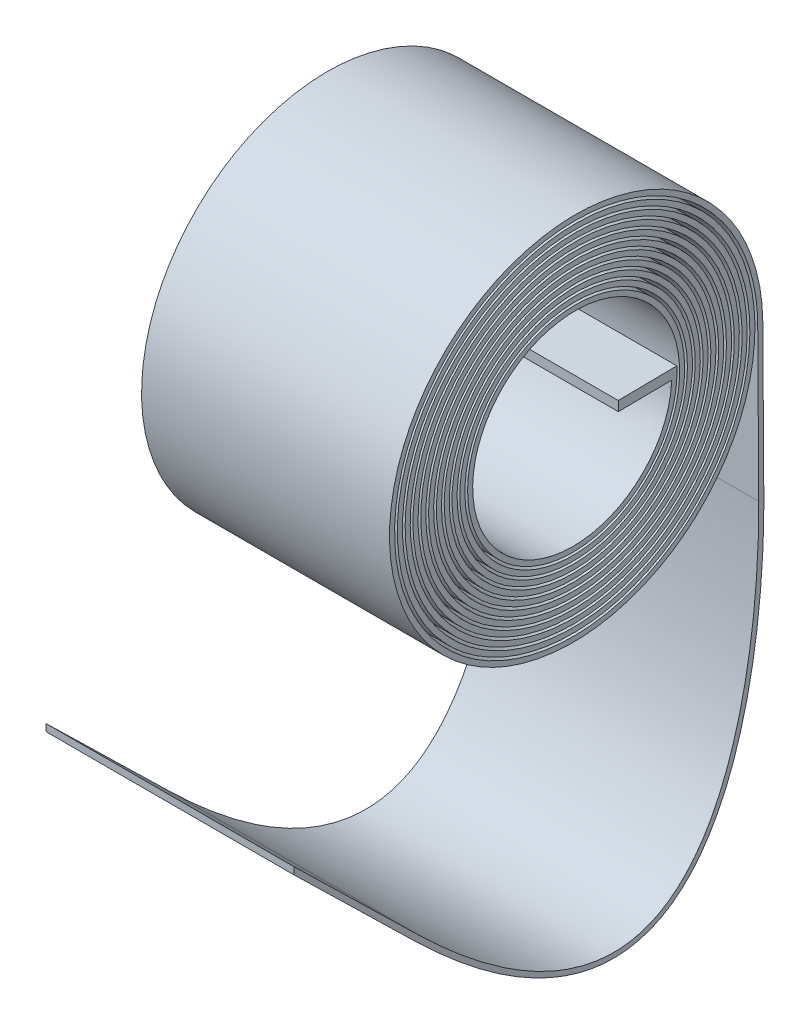
from build123d import *

# Parameters (mm, degrees)
BOSS_EXTRUDE1_DEPTH             = 3.175
BOSS_EXTRUDE2_START             = -3.175
BOSS_EXTRUDE2_DEPTH             = 6.35
BOSS_EXTRUDE3_REACH             = 9.5
BOSS_EXTRUDE3_DIRECTION_2_REACH = 9.5
BOSS_EXTRUDE4_REACH             = 15.516
BOSS_EXTRUDE4_DIRECTION_2_REACH = 15.516


with BuildPart() as part:
    # Sketch2 → Boss-Extrude1 (new, symmetric)
    with BuildSketch(Plane(origin=(0, 0, 0), x_dir=(0, 0, -1), z_dir=(1, 0, 0))):
        with BuildLine():
            Line((2.5, 0), (2.629989464, 0.001655077))
            add(Edge.make_bspline(
                [(2.629989464, 0.001655077), (2.635963048, -0.467509109), (2.386174742, -1.426254548), (1.3228715, -2.463912015), (-0.133184537, -2.81203925), (-1.56988049, -2.358342435), (-2.575295311, -1.223482355), (-2.855850638, 0.276340899), (-2.321964447, 1.715980427), (-1.116319633, 2.682248524), (0.424109992, 2.892390502), (1.862211862, 2.276790995), (2.784768923, 1.001569346), (2.921180104, -0.576112787), (2.222760966, -2.008059754), (0.879404758, -2.882367049), (-0.731935926, -2.941893216), (-2.153003173, -2.15980733), (-2.974560166, -0.75003851), (-2.954225776, 0.891146845), (-2.087893079, 2.296513211), (-0.613712841, 3.060875021), (1.053292415, 2.957896965), (2.438055364, 2.007011844), (3.140849414, 0.470699161), (2.952650537, -1.217900199), (1.917188333, -2.577091277), (0.321297529, -3.214033918), (-1.384479783, -2.938256037), (-2.713080518, -1.818478679), (-3.279993584, -0.165836049), (-2.914509936, 1.552524187), (-1.710970692, 2.845482373), (-0.004670147, 3.338309613), (1.721511339, 2.881236702), (2.973757662, 1.594784014), (3.388580988, -0.161818233), (2.838289781, -1.890905616), (1.47007016, -3.097370569), (-0.333221534, -3.430426071), (-2.060159441, -2.785552495), (-3.215790479, -1.33701247), (-3.463484149, 0.509107584), (-2.72293886, 2.228714941), (-1.195825943, 3.328493817), (0.689020683, 3.487416929), (2.396005649, 2.6503943), (3.434965884, 1.046756981), (3.501909979, -0.872482777), (2.567896279, -2.561458259), (0.890083016, -3.534702682), (-1.058994716, -3.506674101), (-2.724494412, -2.475454827), (-3.627212725, -0.726112043), (-3.501446641, 1.248037594), (-2.373112973, 2.884532528), (-0.555182042, 3.712018828), (1.439074169, 3.48599273), (3.040989658, 2.260947077), (3.788659868, 0.377660305), (3.460106442, -1.631550349), (2.139067051, -3.193283362), (0.193942657, -3.856692518), (-1.824896759, -3.423611881), (-3.340833612, -2.007616484), (-3.915692931, -0.00445258), (-3.376364175, 2.01853036), (-1.866772658, 3.483064701), (0.190359761, 3.965258396), (2.211856143, 3.318250386), (3.619407157, 1.716746456), (4.005008929, -0.390018588), (3.249190332, -2.404268864), (1.557782165, -3.749299667), (-0.594023668, -4.034588818), (-2.595154846, -3.169137308), (-3.872190984, -1.390157167), (-4.053668111, 0.801851569), (-3.078078714, 2.783893812), (-1.214181531, 3.987541834), (1.012956993, 4.061944025), (2.96986077, 2.976036577), (4.0948268, 1.030197485), (4.059142303, -1.2267742), (2.863067977, -3.152427928), (0.838578794, -4.193536181), (-1.442718508, -4.045018483), (-3.330966636, -2.739265363), (-4.283177828, -0.639730026), (-4.019359093, 1.660187867), (-2.604756766, 3.50484936), (-0.434085713, 4.363278942), (1.87856451, 3.981982761), (3.673451667, 2.459705894), (4.433387832, 0.222109415), (3.932741241, -2.097216661), (2.304312132, -3.836154224), (0.004292676, -4.493075624), (-2.31550032, -3.871520338), (-3.992344803, -2.13881042), (-4.541937924, 0.21884611), (-3.798240751, 2.532761088), (-1.96347102, 4.141420287), (0.446762933, 4.579596418), (2.748336059, 3.712858806), (4.282788672, 1.77859918), (4.60570041, -0.678889496), (3.615367094, -2.96155575), (1.584534677, -4.41587105), (-0.914634626, -4.619928297), (-3.171746077, -3.505795002), (-4.540103578, -1.381651255), (-4.621988962, 1.15338578), (-3.384209135, 3.378230365), (-1.170355951, 4.654939427), (1.394510621, 4.6116231), (3.580331386, 3.250713635), (4.75985069, 0.951088307), (4.58860445, -1.637358675), (3.105450381, -3.777373466), (0.724319492, -4.854330117), (-1.881263112, -4.552741482), (-3.968684382, -2.948597087), (-4.937893626, -0.490558734), (-4.503875945, 2.125570274), (-2.78037666, 4.153493985), (-0.25031722, 5.010468273), (2.36951092, 4.440442563), (4.331423794, 2.606435931), (4.824191001, 0.8581671), (4.829997019, 0.000880411)],
                knots=[0, 0, 0, 0, 0.0078125, 0.015625, 0.0234375, 0.03125, 0.0390625, 0.046875, 0.0546875, 0.0625, 0.0703125, 0.078125, 0.0859375, 0.09375, 0.1015625, 0.109375, 0.1171875, 0.125, 0.1328125, 0.140625, 0.1484375, 0.15625, 0.1640625, 0.171875, 0.1796875, 0.1875, 0.1953125, 0.203125, 0.2109375, 0.21875, 0.2265625, 0.234375, 0.2421875, 0.25, 0.2578125, 0.265625, 0.2734375, 0.28125, 0.2890625, 0.296875, 0.3046875, 0.3125, 0.3203125, 0.328125, 0.3359375, 0.34375, 0.3515625, 0.359375, 0.3671875, 0.375, 0.3828125, 0.390625, 0.3984375, 0.40625, 0.4140625, 0.421875, 0.4296875, 0.4375, 0.4453125, 0.453125, 0.4609375, 0.46875, 0.4765625, 0.484375, 0.4921875, 0.5, 0.5078125, 0.515625, 0.5234375, 0.53125, 0.5390625, 0.546875, 0.5546875, 0.5625, 0.5703125, 0.578125, 0.5859375, 0.59375, 0.6015625, 0.609375, 0.6171875, 0.625, 0.6328125, 0.640625, 0.6484375, 0.65625, 0.6640625, 0.671875, 0.6796875, 0.6875, 0.6953125, 0.703125, 0.7109375, 0.71875, 0.7265625, 0.734375, 0.7421875, 0.75, 0.7578125, 0.765625, 0.7734375, 0.78125, 0.7890625, 0.796875, 0.8046875, 0.8125, 0.8203125, 0.828125, 0.8359375, 0.84375, 0.8515625, 0.859375, 0.8671875, 0.875, 0.8828125, 0.890625, 0.8984375, 0.90625, 0.9140625, 0.921875, 0.9296875, 0.9375, 0.9453125, 0.953125, 0.9609375, 0.96875, 0.9765625, 0.984375, 0.9921875, 1, 1, 1, 1], degree=3))
            Line((4.829997019, 0.000880411), (4.7, 0))
            add(Edge.make_bspline(
                [(2.5, 0), (2.505729167, -0.449967698), (2.387069685, -0.902544046), (1.931057786, -1.685641957), (1.594287971, -2.015036668), (0.795104238, -2.455201741), (0.333776976, -2.565301011), (-0.584175452, -2.531677052), (-1.039514917, -2.387937285), (-1.814727156, -1.883737848), (-2.133481458, -1.523929777), (-2.541838167, -0.687331722), (-2.630812522, -0.211683459), (-2.550367961, 0.721985196), (-2.380998157, 1.178694815), (-1.828311313, 1.943141853), (-1.445715419, 2.249773289), (-0.572939687, 2.623691245), (-0.08395497, 2.690396566), (0.863002083, 2.561512466), (1.319641983, 2.366040218), (2.070397129, 1.764734392), (2.363423063, 1.35969181), (2.700318612, 0.452143933), (2.743657634, -0.049114745), (2.564842696, -1.006811623), (2.342876208, -1.461899307), (1.692991953, -2.195998375), (1.265935097, -2.473941356), (0.32518779, -2.771287859), (-0.187206692, -2.790215066), (-1.152980863, -2.560113564), (-1.604995702, -2.311344669), (-2.319446934, -1.613097967), (-2.580840115, -1.164550796), (-2.836178164, -0.192341646), (-2.829704581, 0.329977396), (-2.547103931, 1.301059634), (-2.271310864, 1.748447555), (-1.525095853, 2.440241776), (-1.055673826, 2.683634369), (-0.053902381, 2.894581914), (0.477059751, 2.861779754), (1.450581878, 2.525617694), (1.891760226, 2.222667607), (2.557881196, 1.429058735), (2.781843942, 0.939468449), (2.946106286, -0.089807295), (2.886113467, -0.628063962), (2.49548481, -1.601067031), (2.165336012, -2.0344296), (1.3250896, -2.67186453), (0.816128109, -2.874995177), (-0.238439589, -2.990374805), (-0.782578568, -2.902399288), (-1.75202147, -2.456562241), (-2.175943678, -2.099266155), (-2.781693885, -1.213321359), (-2.962622642, -0.685875177), (-3.027028859, 0.391622468), (-2.910352812, 0.940171551), (-2.408734813, 1.902940018), (-2.024437646, 2.315784225), (-1.093916812, 2.886875875), (-0.548960591, 3.044270833), (0.548960591, 3.055729167), (1.100391518, 2.909712938), (2.053307503, 2.351916004), (2.453428436, 1.940860115), (2.986923363, 0.967068506), (3.119495863, 0.405663407), (3.076157202, -0.710036325), (2.900243077, -1.262768962), (2.28604863, -2.202600367), (1.848573594, -2.588350654), (0.832998508, -3.081357194), (0.256290247, -3.187867122), (-0.874410839, -3.088016561), (-1.426817595, -2.881732297), (-2.350288308, -2.211105458), (-2.720024092, -1.747648815), (-3.169707928, -0.691958066), (-3.248968921, -0.101174654), (-3.091034272, 1.041625289), (-2.853996394, 1.592035748), (-2.127089714, 2.495835977), (-1.638187401, 2.847922598), (-0.544227181, 3.251517549), (0.059323649, 3.302402094), (1.211202073, 3.084962045), (1.757907836, 2.816878891), (2.638704696, 2.034035508), (2.971522421, 1.520321962), (3.326341164, 0.39011407), (3.347785567, -0.224819591), (3.069577443, -1.382646162), (2.770251945, -1.923905885), (1.93200815, -2.77835421), (1.394216095, -3.090303994), (0.229954545, -3.393748664), (-0.394903676, -3.384757885), (-1.555446499, -3.044684995), (-2.08949111, -2.714017185), (-2.914244459, -1.821104382), (-3.203753717, -1.260064276), (-3.453326373, -0.064111285), (-3.412978692, 0.569142999), (-3.010117228, 1.729077469), (-2.648106455, 2.254115549), (-1.701452499, 3.045837372), (-1.118091655, 3.311365749), (0.107026979, 3.50467864), (0.747082342, 3.43213015), (1.903000427, 2.965735613), (2.417223744, 2.572482468), (3.17259867, 1.57321238), (3.412643777, 0.968553752), (3.547429405, -0.283046377), (3.441918315, -0.928245354), (2.911431436, -2.076665287), (2.487139366, -2.57825446), (1.436575405, -3.293999677), (0.81173605, -3.507102792), (-0.463508899, -3.581223711), (-1.112135819, -3.442074435), (-2.249512161, -2.847126582), (-2.736642442, -2.392103192), (-3.409519129, -1.291764284), (-3.594270833, -0.647953485), (-3.605729167, 0.647953485), (-3.432356192, 1.29823899), (-2.772774221, 2.42097305), (-2.287432258, 2.891820205), (-1.139032773, 3.518644985), (-0.477549839, 3.673690715), (0.835897198, 3.620637351), (1.486023007, 3.412548869), (2.590473577, 2.688359411), (3.043219849, 2.173217411), (3.620876221, 0.978665293), (3.744921722, 0.300897036), (3.62566516, -1.026836481), (3.382466437, -1.674940375), (2.593899602, -2.757434763), (2.049582211, -3.190274894), (0.810976446, -3.715724611), (0.118394338, -3.807541276), (-1.220248495, -3.620556079), (-1.864429513, -3.341952571), (-2.921274825, -2.489445037), (-3.332422132, -1.916682992), (-3.802716487, -0.636310429), (-3.861146554, 0.069532553), (-3.605081394, 1.415592523), (-3.290881574, 2.053916366), (-2.375079063, 3.081411017), (-1.774708828, 3.469103485), (-0.45504035, 3.881394468), (0.262432489, 3.905356067), (1.612311462, 3.579041321), (2.242816068, 3.229159221), (3.237261486, 2.250918334), (3.599767872, 1.623881395), (3.951319165, 0.267567443), (3.93981119, -0.459829956), (3.54226606, -1.809833364), (3.156723506, -2.430534664), (2.117112911, -3.388247142), (1.464454726, -3.723873066), (0.074320189, -4.012070833), (-0.661226247, -3.964177629), (-2.00757306, -3.494616763), (-2.616470871, -3.073545303), (-3.533793548, -1.973846264), (-3.840887555, -1.296714861), (-4.063250995, 0.124246663), (-3.978146833, 0.866100721), (-3.435986415, 2.204933823), (-2.979628923, 2.800017889), (-1.821335159, 3.67333281), (-1.120979395, 3.950292376), (0.327653166, 4.104484005), (1.07391214, 3.981437342), (2.401309104, 3.366300631), (2.980565242, 2.875012577), (3.806305469, 1.65982945), (4.051582942, 0.937596923), (4.135418563, -0.53539533), (3.973796057, -1.284100086), (3.28551835, -2.596084304), (2.759768739, -3.157500659), (1.489611756, -3.932162383), (0.746946378, -4.144270833), (-0.746946378, -4.155729167), (-1.496086463, -3.954999446), (-2.788638596, -3.193632438), (-3.330211973, -2.634004401), (-4.050366608, -1.310997041), (-4.227885567, -0.54943627), (-4.165117501, 0.961758071), (-3.92485466, 1.709277053), (-3.090670193, 2.978346788), (-2.497861228, 3.498089044), (-1.124332079, 4.160395248), (-0.345503824, 4.301976322), (1.179262124, 4.163313759), (1.923063154, 3.883200577), (3.164581218, 2.976693747), (3.660525697, 2.351515607), (4.261741294, 0.929994826), (4.366113631, 0.135614022), (4.150077885, -1.398871701), (3.829908747, -2.136823277), (2.851800359, -3.346713673), (2.195178582, -3.816921667), (0.728393677, -4.353915424), (-0.079741457, -4.419891013), (-1.619982973, -4.125200742), (-2.349924895, -3.764884257), (-3.524117338, -2.716122618), (-3.96668455, -2.029095693), (-4.436447773, -0.519966629), (-4.462926567, 0.300045387), (-4.088505199, 1.841976761), (-3.688066497, 2.561726252), (-2.569828517, 3.696168762), (-1.853546694, 4.10923175), (-0.305180341, 4.508889665), (0.524756236, 4.494864495), (2.06422023, 4.039847124), (2.771578219, 3.599429827), (3.862249825, 2.41312144), (4.243992415, 1.668845176), (4.570815293, 0.084529093), (4.515376566, -0.753309495), (3.979116297, -2.286068651), (3.498984151, -2.978826194), (2.246240029, -4.021749724), (1.475338066, -4.370409361), (0.262734756, -4.558969853), (-0.150355994, -4.56698232), (-0.964537483, -4.472335191), (-1.365556131, -4.369681942), (-2.12643019, -4.060718792), (-2.486217689, -3.854434291), (-3.138344868, -3.352776566), (-3.430625762, -3.057446018), (-3.926253221, -2.398787299), (-4.129554429, -2.035516046), (-4.432112301, -1.267083251), (-4.531340383, -0.86198879), (-4.618139198, -0.039156294), (-4.605700263, 0.378509332), (-4.469630521, 1.196209941), (-4.346009733, 1.596172424), (-3.996116462, 2.349359422), (-3.76987303, 2.702516612), (-3.230759384, 3.336270438), (-2.917935215, 3.616809833), (-2.228034069, 4.084677451), (-1.851016848, 4.271962711), (-1.059851677, 4.539362078), (-0.645772907, 4.619450673), (0.189596872, 4.666225834), (0.610814266, 4.632906257), (1.429908379, 4.454844363), (1.827712377, 4.310115789), (2.571008424, 3.919312009), (2.916433931, 3.673269507), (3.529692756, 3.097309082), (3.797470566, 2.767440521), (4.235693947, 2.047452993), (4.406099115, 1.657396521), (4.636831003, 0.845119274), (4.697135417, 0.422969636), (4.7, 0)],
                knots=[0, 0, 0, 0, 0.0078125, 0.0078125, 0.015625, 0.015625, 0.0234375, 0.0234375, 0.03125, 0.03125, 0.0390625, 0.0390625, 0.046875, 0.046875, 0.0546875, 0.0546875, 0.0625, 0.0625, 0.0703125, 0.0703125, 0.078125, 0.078125, 0.0859375, 0.0859375, 0.09375, 0.09375, 0.1015625, 0.1015625, 0.109375, 0.109375, 0.1171875, 0.1171875, 0.125, 0.125, 0.1328125, 0.1328125, 0.140625, 0.140625, 0.1484375, 0.1484375, 0.15625, 0.15625, 0.1640625, 0.1640625, 0.171875, 0.171875, 0.1796875, 0.1796875, 0.1875, 0.1875, 0.1953125, 0.1953125, 0.203125, 0.203125, 0.2109375, 0.2109375, 0.21875, 0.21875, 0.2265625, 0.2265625, 0.234375, 0.234375, 0.2421875, 0.2421875, 0.25, 0.25, 0.2578125, 0.2578125, 0.265625, 0.265625, 0.2734375, 0.2734375, 0.28125, 0.28125, 0.2890625, 0.2890625, 0.296875, 0.296875, 0.3046875, 0.3046875, 0.3125, 0.3125, 0.3203125, 0.3203125, 0.328125, 0.328125, 0.3359375, 0.3359375, 0.34375, 0.34375, 0.3515625, 0.3515625, 0.359375, 0.359375, 0.3671875, 0.3671875, 0.375, 0.375, 0.3828125, 0.3828125, 0.390625, 0.390625, 0.3984375, 0.3984375, 0.40625, 0.40625, 0.4140625, 0.4140625, 0.421875, 0.421875, 0.4296875, 0.4296875, 0.4375, 0.4375, 0.4453125, 0.4453125, 0.453125, 0.453125, 0.4609375, 0.4609375, 0.46875, 0.46875, 0.4765625, 0.4765625, 0.484375, 0.484375, 0.4921875, 0.4921875, 0.5, 0.5, 0.5078125, 0.5078125, 0.515625, 0.515625, 0.5234375, 0.5234375, 0.53125, 0.53125, 0.5390625, 0.5390625, 0.546875, 0.546875, 0.5546875, 0.5546875, 0.5625, 0.5625, 0.5703125, 0.5703125, 0.578125, 0.578125, 0.5859375, 0.5859375, 0.59375, 0.59375, 0.6015625, 0.6015625, 0.609375, 0.609375, 0.6171875, 0.6171875, 0.625, 0.625, 0.6328125, 0.6328125, 0.640625, 0.640625, 0.6484375, 0.6484375, 0.65625, 0.65625, 0.6640625, 0.6640625, 0.671875, 0.671875, 0.6796875, 0.6796875, 0.6875, 0.6875, 0.6953125, 0.6953125, 0.703125, 0.703125, 0.7109375, 0.7109375, 0.71875, 0.71875, 0.7265625, 0.7265625, 0.734375, 0.734375, 0.7421875, 0.7421875, 0.75, 0.75, 0.7578125, 0.7578125, 0.765625, 0.765625, 0.7734375, 0.7734375, 0.78125, 0.78125, 0.7890625, 0.7890625, 0.796875, 0.796875, 0.8046875, 0.8046875, 0.8125, 0.8125, 0.8203125, 0.8203125, 0.828125, 0.828125, 0.8359375, 0.8359375, 0.84375, 0.84375, 0.8515625, 0.8515625, 0.859375, 0.859375, 0.8671875, 0.8671875, 0.875, 0.875, 0.8828125, 0.8828125, 0.890625, 0.890625, 0.8984375, 0.8984375, 0.90625, 0.90625, 0.9140625, 0.9140625, 0.921875, 0.921875, 0.9296875, 0.9296875, 0.93359375, 0.93359375, 0.9375, 0.9375, 0.94140625, 0.94140625, 0.9453125, 0.9453125, 0.94921875, 0.94921875, 0.953125, 0.953125, 0.95703125, 0.95703125, 0.9609375, 0.9609375, 0.96484375, 0.96484375, 0.96875, 0.96875, 0.97265625, 0.97265625, 0.9765625, 0.9765625, 0.98046875, 0.98046875, 0.984375, 0.984375, 0.98828125, 0.98828125, 0.9921875, 0.9921875, 0.99609375, 0.99609375, 1, 1, 1, 1], degree=3))
        make_face()
    extrude(amount=BOSS_EXTRUDE1_DEPTH, both=True)

    # Sketch4 → Boss-Extrude2 (add)
    with BuildSketch(Plane(origin=(0, 0, 0), x_dir=(0, 0, -1), z_dir=(1, 0, 0)).offset(BOSS_EXTRUDE2_START)):
        Polygon((2.631580884, -0.123334792), (2.628398043, 0.126644946), (1.128519614, 0.107547901), (1.131702455, -0.142431837), align=None)
    extrude(amount=BOSS_EXTRUDE2_DEPTH)

    # Boss-Extrude3: up to this face of the body (flat: up to its plane)
    boss_extrude3_end = Plane(part.part.faces().sort_by_distance((3.175, 0.000743861, -1.813340642))[0])
    # Sketch5 → Boss-Extrude3 (add, up to the picked face)
    with BuildSketch(Plane(origin=(0, 0, 0), x_dir=(0, 0, -1), z_dir=(1, 0, 0)), mode=Mode.PRIVATE) as boss_extrude3_sk1:
        with BuildLine():
            Line((4.829997019, 0.000880411), (4.856605868, -3.928045346))
            add(Edge.make_bspline(
                [(4.856605868, -3.928045346), (4.883532034, -7.913418019), (3.668224987, -16.833462661), (-4.117958812, -9.243059566)],
                knots=[0, 0, 0, 0, 1, 1, 1, 1], degree=3))
            Line((-4.117958812, -9.243059566), (-4.027212696, -9.149972819))
            add(Edge.make_bspline(
                [(4.726608835, -3.928923638), (4.728398648, -4.193835881), (4.72192879, -4.701677009), (4.660494346, -5.892790449), (4.472375837, -7.490242604), (4.008629779, -9.370007472), (3.248818664, -10.944397091), (2.157285415, -11.957200571), (0.926111508, -12.171154011), (-0.325782492, -11.83993469), (-1.402877716, -11.301532016), (-2.426314136, -10.577371064), (-3.309100914, -9.830393356), (-3.796437401, -9.374945355), (-4.027212696, -9.149972819)],
                knots=[0, 0, 0, 0, 0.0625, 0.125, 0.25, 0.375, 0.5, 0.625, 0.75, 0.8125, 0.875, 0.9375, 0.96875, 1, 1, 1, 1], degree=3))
            Line((4.726608835, -3.928923638), (4.7, 0))
            Line((4.7, 0), (4.829997019, 0.000880411))
        make_face()
    boss_extrude3_tool1 = split(extrude(boss_extrude3_sk1.sketch, amount=BOSS_EXTRUDE3_REACH, mode=Mode.PRIVATE), bisect_by=boss_extrude3_end, keep=Keep.BOTH, mode=Mode.PRIVATE)
    add(boss_extrude3_tool1.solids().sort_by(Axis((0, -1.963685, -4.82815), (1, 0, 0)))[0])

    # Boss-Extrude3 direction 2: up to this face of the body (flat: up to its plane)
    boss_extrude3_direction_2_end = Plane(part.part.faces().sort_by_distance((-3.175, -0.017378588, -1.880171018))[0])
    # Sketch5 → Boss-Extrude3 direction 2 (add, up to the picked face)
    with BuildSketch(Plane(origin=(0, 0, 0), x_dir=(0, 0, -1), z_dir=(1, 0, 0)), mode=Mode.PRIVATE) as boss_extrude3_direction_2_sk1:
        with BuildLine():
            Line((4.829997019, 0.000880411), (4.856605868, -3.928045346))
            add(Edge.make_bspline(
                [(4.856605868, -3.928045346), (4.883532034, -7.913418019), (3.668224987, -16.833462661), (-4.117958812, -9.243059566)],
                knots=[0, 0, 0, 0, 1, 1, 1, 1], degree=3))
            Line((-4.117958812, -9.243059566), (-4.027212696, -9.149972819))
            add(Edge.make_bspline(
                [(4.726608835, -3.928923638), (4.728398648, -4.193835881), (4.72192879, -4.701677009), (4.660494346, -5.892790449), (4.472375837, -7.490242604), (4.008629779, -9.370007472), (3.248818664, -10.944397091), (2.157285415, -11.957200571), (0.926111508, -12.171154011), (-0.325782492, -11.83993469), (-1.402877716, -11.301532016), (-2.426314136, -10.577371064), (-3.309100914, -9.830393356), (-3.796437401, -9.374945355), (-4.027212696, -9.149972819)],
                knots=[0, 0, 0, 0, 0.0625, 0.125, 0.25, 0.375, 0.5, 0.625, 0.75, 0.8125, 0.875, 0.9375, 0.96875, 1, 1, 1, 1], degree=3))
            Line((4.726608835, -3.928923638), (4.7, 0))
            Line((4.7, 0), (4.829997019, 0.000880411))
        make_face()
    boss_extrude3_direction_2_tool1 = split(extrude(boss_extrude3_direction_2_sk1.sketch, amount=-BOSS_EXTRUDE3_DIRECTION_2_REACH, mode=Mode.PRIVATE), bisect_by=boss_extrude3_direction_2_end, keep=Keep.BOTH, mode=Mode.PRIVATE)
    add(boss_extrude3_direction_2_tool1.solids().sort_by(Axis((0, -1.963685, -4.82815), (-1, 0, 0)))[0])

    # Boss-Extrude4: up to this face of the body (flat: up to its plane)
    boss_extrude4_end = Plane(part.part.faces().sort_by_distance((3.175, 0.0613027, -1.812569583))[0])
    # Sketch6 → Boss-Extrude4 (add, up to the picked face)
    with BuildSketch(Plane(origin=(0, 0, 0), x_dir=(0, 0, -1), z_dir=(1, 0, 0)), mode=Mode.PRIVATE) as boss_extrude4_sk1:
        Polygon((-4.027212696, -9.149972819), (-4.117958812, -9.243059566), (-7.170793915, -6.266986871), (-7.173134546, -6.083154008), align=None)
    boss_extrude4_tool1 = split(extrude(boss_extrude4_sk1.sketch, amount=BOSS_EXTRUDE4_REACH, mode=Mode.PRIVATE), bisect_by=boss_extrude4_end, keep=Keep.BOTH, mode=Mode.PRIVATE)
    add(boss_extrude4_tool1.solids().sort_by(Axis((0, -7.685447, 5.622164), (1, 0, 0)))[0])

    # Boss-Extrude4 direction 2: up to this face of the body (flat: up to its plane)
    boss_extrude4_direction_2_end = Plane(part.part.faces().sort_by_distance((-3.175, -0.077937426, -1.880942077))[0])
    # Sketch6 → Boss-Extrude4 direction 2 (add, up to the picked face)
    with BuildSketch(Plane(origin=(0, 0, 0), x_dir=(0, 0, -1), z_dir=(1, 0, 0)), mode=Mode.PRIVATE) as boss_extrude4_direction_2_sk1:
        Polygon((-4.027212696, -9.149972819), (-4.117958812, -9.243059566), (-7.170793915, -6.266986871), (-7.173134546, -6.083154008), align=None)
    boss_extrude4_direction_2_tool1 = split(extrude(boss_extrude4_direction_2_sk1.sketch, amount=-BOSS_EXTRUDE4_DIRECTION_2_REACH, mode=Mode.PRIVATE), bisect_by=boss_extrude4_direction_2_end, keep=Keep.BOTH, mode=Mode.PRIVATE)
    add(boss_extrude4_direction_2_tool1.solids().sort_by(Axis((0, -7.685447, 5.622164), (-1, 0, 0)))[0])


solid = part.part
